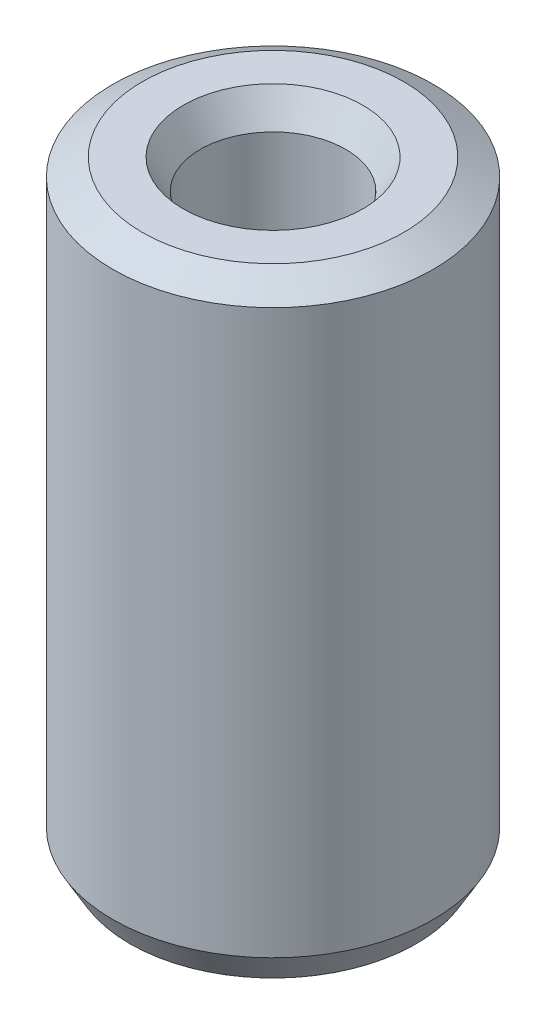
from build123d import *
from OCP.BRepFilletAPI import BRepFilletAPI_MakeChamfer

# Parameters (mm, degrees)
SKETCH1_R           = 15
BOSS_EXTRUDE1_DEPTH = 57.058999029
SKETCH2_R           = 6.805380741
CUT_EXTRUDE1_DEPTH  = 61.874702218
CHAMFER1_SIZE       = 1.601411924
CHAMFER1_SIZE2      = 2.773726816


with BuildPart() as part:
    # Sketch1 → Boss-Extrude1 (new body)
    with BuildSketch(Plane(origin=(0, 0, 0), x_dir=(1, 0, 0), z_dir=(0, 1, 0))):
        Circle(SKETCH1_R)
    extrude(amount=BOSS_EXTRUDE1_DEPTH)

    # Sketch2 → Cut-Extrude1 (cut, through all)
    with BuildSketch(Plane(origin=(0, 0, 0), x_dir=(1, 0, 0), z_dir=(0, 1, 0))):
        Circle(SKETCH2_R)
    extrude(amount=CUT_EXTRUDE1_DEPTH, mode=Mode.SUBTRACT)

    # Chamfer1: one chamfer whose edges measure the first distance from different faces: ONE call of the kernel's chamfer builder (chamfer() names one face for all edges)
    chamfer1_edges_1 = [part.edges().sort_by_distance(p)[0] for p in [
        (-6.805380741, 57.058999029, 0),
    ]]
    chamfer1_side_1 = [part.faces().sort_by_distance(p)[0] for p in [
        (-14.575735931, 57.058999029, 0),
    ]]
    chamfer1_edges_2 = [part.edges().sort_by_distance(p)[0] for p in [
        (-6.805380741, 0, 0),
    ]]
    chamfer1_side_2 = [part.faces().sort_by_distance(p)[0] for p in [
        (-6.805380741, 28.529499514, 0),
    ]]
    chamfer1_edges_3 = [part.edges().sort_by_distance(p)[0] for p in [
        (-15, 0, 0),
    ]]
    chamfer1_side_3 = [part.faces().sort_by_distance(p)[0] for p in [
        (-14.575735931, 0, 0),
    ]]
    chamfer1_edges_4 = [part.edges().sort_by_distance(p)[0] for p in [
        (-15, 57.058999029, 0),
    ]]
    chamfer1_side_4 = [part.faces().sort_by_distance(p)[0] for p in [
        (-15, 28.529499514, 0),
    ]]
    chamfer1 = BRepFilletAPI_MakeChamfer(part.part.solid().wrapped)
    for e in chamfer1_edges_1:
        chamfer1.Add(CHAMFER1_SIZE, CHAMFER1_SIZE2, e.wrapped, chamfer1_side_1[0].wrapped)  # the first distance lies on this face
    for e in chamfer1_edges_2:
        chamfer1.Add(CHAMFER1_SIZE, CHAMFER1_SIZE2, e.wrapped, chamfer1_side_2[0].wrapped)  # the first distance lies on this face
    for e in chamfer1_edges_3:
        chamfer1.Add(CHAMFER1_SIZE, CHAMFER1_SIZE2, e.wrapped, chamfer1_side_3[0].wrapped)  # the first distance lies on this face
    for e in chamfer1_edges_4:
        chamfer1.Add(CHAMFER1_SIZE, CHAMFER1_SIZE2, e.wrapped, chamfer1_side_4[0].wrapped)  # the first distance lies on this face
    add(Compound.cast(chamfer1.Shape()), mode=Mode.REPLACE)


solid = part.part
